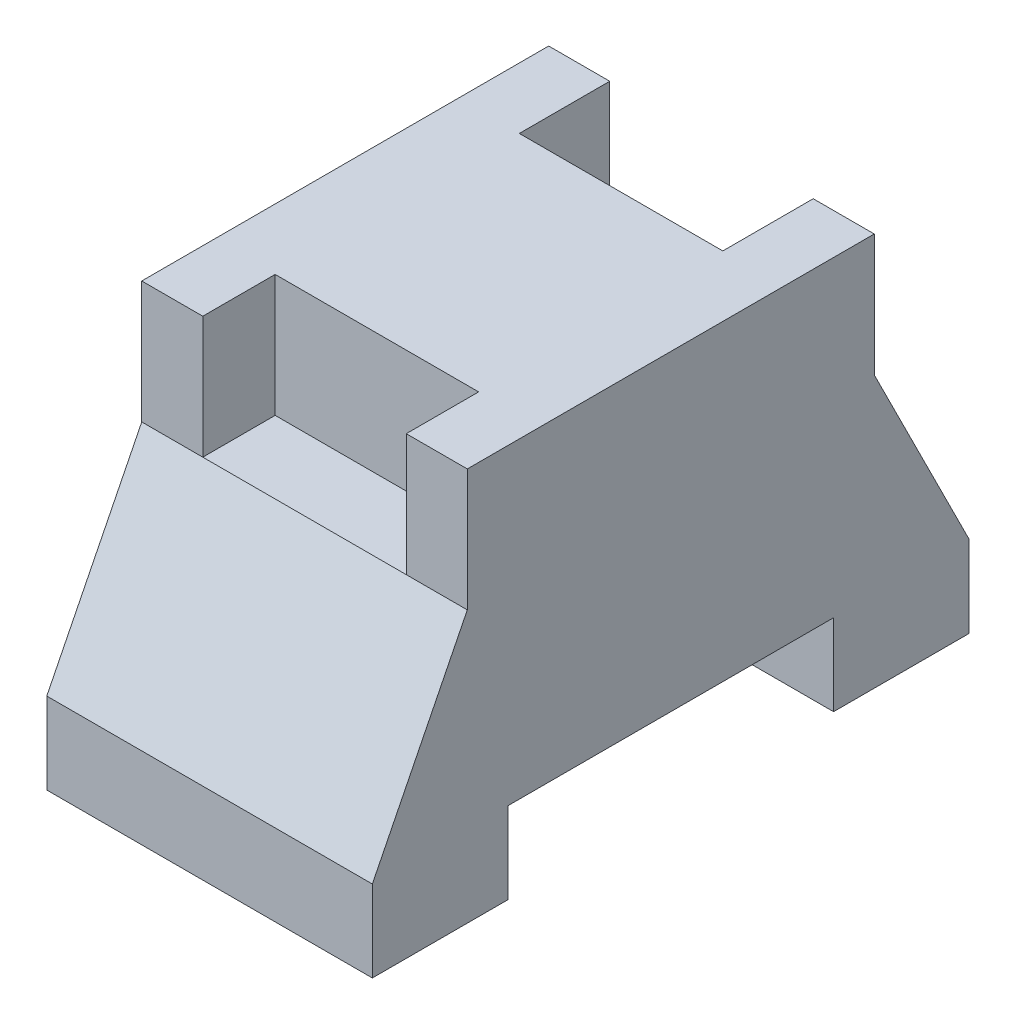
from build123d import *

# Parameters (mm, degrees)
BOSS_EXTRUDE1_START = -48
BOSS_EXTRUDE1_DEPTH = 48
SKETCH3_W           = 30
SKETCH3_H           = 10.671288352
SKETCH3_H_2         = 13.328711648
CUT_EXTRUDE1_DEPTH  = 18


# Read off the part's stored shape, not the designer's step: Boss-Extrude1
with BuildPart() as part:
    # Boss-Extrude1 outline → Boss-Extrude1 (new body)
    with BuildSketch(Plane(origin=(0, 0, 0), x_dir=(0, 0, -1), z_dir=(1, 0, 0)).offset(BOSS_EXTRUDE1_START)):
        Polygon((-31.189156063, -12), (-31.189156063, 0), (16.810843937, 0), (16.810843937, -12), (36.810843937, -12), (36.810843937, 0), (22.810843937, 28), (22.810843937, 46), (-37.189156063, 46), (-37.189156063, 28), (-51.189156063, 0), (-51.189156063, -12), align=None)
    extrude(amount=BOSS_EXTRUDE1_DEPTH)

    # Sketch3 → Cut-Extrude1 (cut)
    with BuildSketch(Plane(origin=(0, 46, 0), x_dir=(1, 0, 0), z_dir=(0, 1, 0))):
        with Locations((-24, -31.853511887)):
            Rectangle(SKETCH3_W, SKETCH3_H)
        with Locations((-24, 16.146488113)):
            Rectangle(SKETCH3_W, SKETCH3_H_2)
    extrude(amount=-CUT_EXTRUDE1_DEPTH, mode=Mode.SUBTRACT)


solid = part.part
